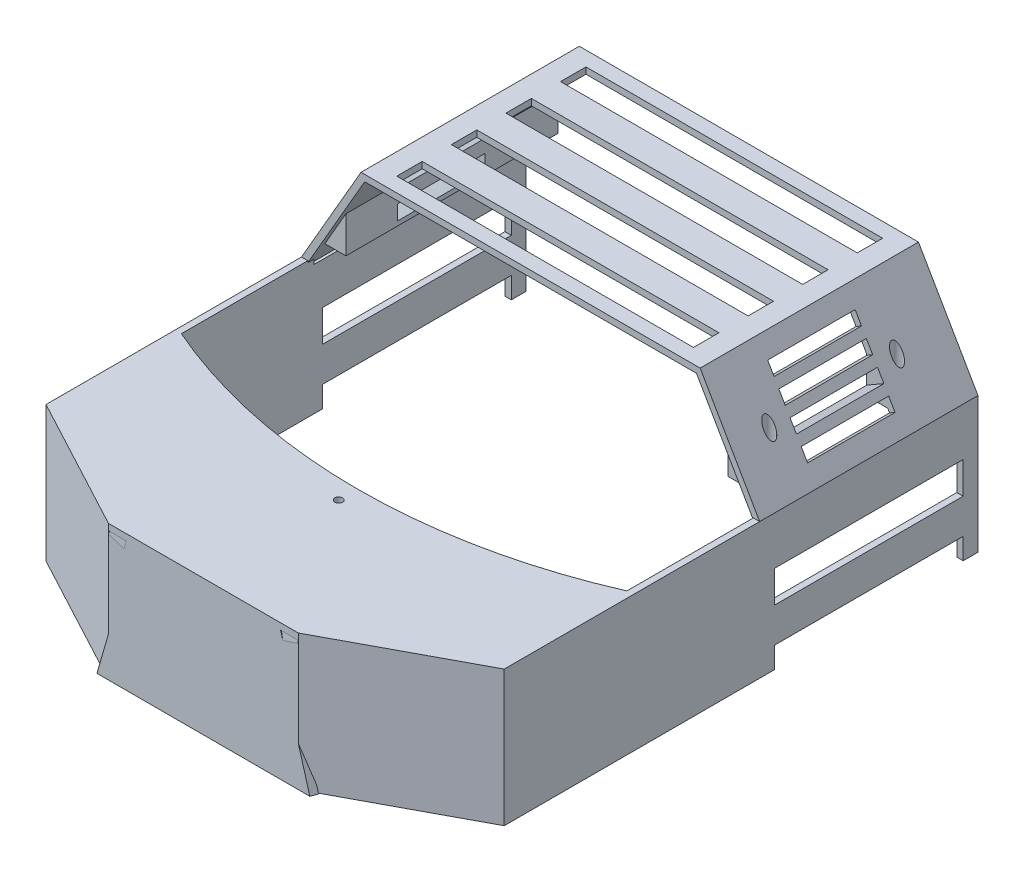
from build123d import *

# Parameters (mm, degrees)
SALIENTE_EXTRUIR15_DEPTH = 3
SALIENTE_EXTRUIR16_REACH = 85.791
CHAFL_N1_SIZE            = 8
CHAFL_N1_SIZE_2          = 2.205109306
CHAFL_N2_SIZE            = 2.205109306
CHAFL_N2_SIZE_2          = 8
SALIENTE_EXTRUIR17_DEPTH = 3
SALIENTE_EXTRUIR18_DEPTH = 102.97
CROQUIS28_R              = 1.825
CORTAR_EXTRUIR6_DEPTH    = 283.951050372
SALIENTE_EXTRUIR19_DEPTH = 100
CROQUIS30_R              = 1.65
CORTAR_EXTRUIR7_DEPTH    = 283.951050372
CORTAR_EXTRUIR9_REACH    = 302.941
CORTAR_EXTRUIR10_START   = -40.653307
CROQUIS34_R              = 2.5
CORTAR_EXTRUIR10_DEPTH   = 35
CROQUIS35_W              = 41.244426213
CROQUIS35_H              = 6
CORTAR_EXTRUIR11_DEPTH   = 17
CROQUIS36_W              = 41.244426207
CROQUIS36_H              = 6
CORTAR_EXTRUIR12_DEPTH   = 17
CROQUIS37_W              = 139.956448948
CROQUIS37_H              = 12
CORTAR_EXTRUIR13_DEPTH   = 3
CROQUIS39_W              = 88.97
CROQUIS39_H              = 15
CROQUIS39_H_2            = 10
CORTAR_EXTRUIR14_DEPTH   = 353.231866742
CHAFL_N4_SIZE            = 3.639702343
CHAFL_N4_SIZE_2          = 10


with BuildPart() as part:
    # Croquis22 → Saliente-Extruir15 (new body)
    with BuildSketch(Plane.XY):
        Polygon((-54, 0), (54, 0), (35.527349199, 64), (-35.527349199, 64), align=None)
    extrude(amount=SALIENTE_EXTRUIR15_DEPTH)

    # Saliente-Extruir16: up to this face of the body (flat: up to its plane)
    saliente_extruir16_end = Plane(part.part.faces().sort_by_distance((0, 0, 1.5))[0])
    # Croquis23 → Saliente-Extruir16 (add, up to the picked face)
    with BuildSketch(Plane(origin=(0, 64, 0), x_dir=(1, 0, 0), z_dir=(0, 1, 0)), mode=Mode.PRIVATE) as saliente_extruir16_sk1:
        Polygon((108.068224474, 30.82636567), (108.068224474, 254.28636567), (105.068224474, 254.28636567), (105.068224474, 32.737576452), (34.862265211, 0), (44.7636746, -3), align=None)
    saliente_extruir16_tool1 = split(extrude(saliente_extruir16_sk1.sketch, amount=-SALIENTE_EXTRUIR16_REACH, mode=Mode.PRIVATE), bisect_by=saliente_extruir16_end, keep=Keep.BOTH, mode=Mode.PRIVATE)
    # Croquis23 → Saliente-Extruir16 (add, up to the picked face)
    with BuildSketch(Plane(origin=(0, 64, 0), x_dir=(1, 0, 0), z_dir=(0, 1, 0)), mode=Mode.PRIVATE) as saliente_extruir16_sk2:
        Polygon((-44.7636746, -3), (-108.068224474, 30.82636567), (-108.068224474, 254.28636567), (-105.068224474, 254.28636567), (-105.068224474, 32.737576452), (-34.862265211, 0), align=None)
    saliente_extruir16_tool2 = split(extrude(saliente_extruir16_sk2.sketch, amount=-SALIENTE_EXTRUIR16_REACH, mode=Mode.PRIVATE), bisect_by=saliente_extruir16_end, keep=Keep.BOTH, mode=Mode.PRIVATE)
    add(saliente_extruir16_tool1.solids().sort_by(Axis((105.393241, 64, -142.556366), (0, -1, 0)))[0])
    add(saliente_extruir16_tool2.solids().sort_by(Axis((-75.155279, 64, -16.272473), (0, -1, 0)))[0])

    # Chaflán1
    # the kernel refuses this chamfer: 8, 2.205109306 mm, written as the material it adds along each edge
    with BuildSketch(Plane(origin=(-50.503325007, 12.114514694, 4.739040428), x_dir=(-0.919298302367056, 0.2887303877017334, 0.267442319917128), z_dir=(0.2763409092722936, 0.9574055388276669, -0.0837277497886264))) as chafl_n1_piece_1_section:
        Polygon((CHAFL_N1_SIZE * 0.999943641705, CHAFL_N1_SIZE * 0.0106166574103), (CHAFL_N1_SIZE_2 * 0.268384707917, CHAFL_N1_SIZE_2 * 0.963311812656), (0, 0), align=None)
    chafl_n1_piece_1 = extrude(amount=74.96402277, mode=Mode.PRIVATE)
    chafl_n1_piece_1 = split(chafl_n1_piece_1, bisect_by=Plane(origin=(-40.189826284, 64, 2.253573464), z_dir=(0, -1, 0)), keep=Keep.TOP, mode=Mode.PRIVATE)
    chafl_n1_piece_1 = split(chafl_n1_piece_1, bisect_by=Plane(origin=(-40.189826284, 55.464802275, 3), z_dir=(0, 0, -1)), keep=Keep.TOP, mode=Mode.PRIVATE)
    add(chafl_n1_piece_1)

    # Chaflán2
    # the kernel refuses this chamfer: 8, 2.205109306 mm, written as the material it adds along each edge
    with BuildSketch(Plane(origin=(50.503325007, 12.114514694, 4.739040428), x_dir=(-0.1610184044916604, 0.03976595413217484, 0.9861499593403216), z_dir=(-0.27634090927229366, 0.957405538827667, -0.08372774978862642))) as chafl_n2_piece_1_section:
        Polygon((CHAFL_N2_SIZE * 0.989624861472, CHAFL_N2_SIZE * 0.143675444677), (CHAFL_N2_SIZE_2 * 0.137719182616, CHAFL_N2_SIZE_2 * 0.990471315455), (0, 0), align=None)
    chafl_n2_piece_1 = extrude(amount=74.96402277, mode=Mode.PRIVATE)
    chafl_n2_piece_1 = split(chafl_n2_piece_1, bisect_by=Plane(origin=(40.189826284, 55.464802275, 3), z_dir=(0, 0, -1)), keep=Keep.TOP, mode=Mode.PRIVATE)
    chafl_n2_piece_1 = split(chafl_n2_piece_1, bisect_by=Plane(origin=(40.189826284, 64, 2.253573464), z_dir=(0, -1, 0)), keep=Keep.TOP, mode=Mode.PRIVATE)
    add(chafl_n2_piece_1)

    # Croquis24 → Saliente-Extruir17 (add)
    with BuildSketch(Plane(origin=(0, 64, 0), x_dir=(1, 0, 0), z_dir=(0, 1, 0))):
        with BuildLine():
            Line((-108.068224474, 93.00636567), (-108.068224474, 30.82636567))
            Line((-108.068224474, 30.82636567), (-44.7636746, -3))
            Line((-44.7636746, -3), (44.7636746, -3))
            Line((44.7636746, -3), (108.068224474, 30.82636567))
            Line((108.068224474, 30.82636567), (108.068224474, 93.00636567))
            ThreePointArc((108.068224474, 93.00636567), (0, 69.74), (-108.068224474, 93.00636567))
        make_face()
    extrude(amount=-SALIENTE_EXTRUIR17_DEPTH)

    # Croquis25 → Saliente-Extruir18 (add)
    with BuildSketch(Plane(origin=(0, 0, -254.28636567), x_dir=(-1, 0, 0), z_dir=(0, 0, -1))):
        Polygon((-108.068224474, 64), (-79.978224474, 112.653307185), (79.978224474, 112.653307185), (108.068224474, 64), (105.068224474, 63.196152423), (78.246173666, 109.653307185), (-78.246173666, 109.653307185), (-105.068224474, 63.196152423), align=None)
    extrude(amount=-SALIENTE_EXTRUIR18_DEPTH)

    # Croquis28 → Cortar-Extruir6 (cut, through all)
    with BuildSketch(Plane.XZ.offset(-61)):
        with Locations(Location((-0.001775526, -60.825, 0), (0, 0, 270))):
            Circle(CROQUIS28_R)
    extrude(amount=-CORTAR_EXTRUIR6_DEPTH, mode=Mode.SUBTRACT)

    # Croquis29 → Saliente-Extruir19 (add)
    with BuildSketch(Plane(origin=(0, 0, -254.28636567), x_dir=(-1, 0, 0), z_dir=(0, 0, -1))):
        Polygon((-105.068224474, 61), (-90.068224474, 61), (-90.068224474, 89.176914536), (-105.068224474, 63.196152423), align=None)
        Polygon((105.068224474, 61), (105.068224474, 63.196152423), (90.068224474, 89.176914536), (90.068224474, 61), align=None)
    extrude(amount=-SALIENTE_EXTRUIR19_DEPTH)

    # Croquis30 → Cortar-Extruir7 (cut, through all)
    with BuildSketch(Plane.XZ.offset(-61)):
        with Locations(Location((94.857727132, -169.052479414, 0), (0, 0, 270))):
            Circle(CROQUIS30_R)
        with Locations(Location((94.857727132, -229.296905627, 0), (0, 0, 270))):
            Circle(CROQUIS30_R)
        with Locations(Location((-94.857727132, -229.296905627, 0), (0, 0, 180))):
            Circle(CROQUIS30_R)
        with Locations(Location((-94.857727132, -169.052479414, 0), (0, 0, 180))):
            Circle(CROQUIS30_R)
    extrude(amount=-CORTAR_EXTRUIR7_DEPTH, mode=Mode.SUBTRACT)

    # Cortar-Extruir9: up to this face of the body (flat: up to its plane)
    cortar_extruir9_end = Plane(part.part.faces().sort_by_distance((95.429754053, 70.445236449, -154.28636567))[0])
    # Croquis33 → Cortar-Extruir9 (cut, up to the picked face)
    with BuildSketch(Plane(origin=(0, 0, -254.28636567), x_dir=(-1, 0, 0), z_dir=(0, 0, -1)), mode=Mode.PRIVATE) as cortar_extruir9_sk1:
        Polygon((-90.068224474, 61), (-90.068224474, 72), (-99.985320705, 72), (-106.336173666, 61), align=None)
    cortar_extruir9_tool1 = split(extrude(cortar_extruir9_sk1.sketch, amount=-CORTAR_EXTRUIR9_REACH, mode=Mode.PRIVATE), bisect_by=cortar_extruir9_end, keep=Keep.BOTH, mode=Mode.PRIVATE)
    # Croquis33 → Cortar-Extruir9 (cut, up to the picked face)
    with BuildSketch(Plane(origin=(0, 0, -254.28636567), x_dir=(-1, 0, 0), z_dir=(0, 0, -1)), mode=Mode.PRIVATE) as cortar_extruir9_sk2:
        Polygon((99.985320705, 72), (106.336173666, 61), (90.068224474, 61), (90.068224474, 72), align=None)
    cortar_extruir9_tool2 = split(extrude(cortar_extruir9_sk2.sketch, amount=-CORTAR_EXTRUIR9_REACH, mode=Mode.PRIVATE), bisect_by=cortar_extruir9_end, keep=Keep.BOTH, mode=Mode.PRIVATE)
    add(cortar_extruir9_tool1.solids().sort_by(Axis((96.742846, 66.055348, -254.286366), (0, 0, 1)))[0], mode=Mode.SUBTRACT)
    add(cortar_extruir9_tool2.solids().sort_by(Axis((-96.742846, 66.055348, -254.286366), (0, 0, 1)))[0], mode=Mode.SUBTRACT)

    # Croquis34 → Cortar-Extruir10 (cut)
    with BuildSketch(Plane.XZ.offset(-72).offset(CORTAR_EXTRUIR10_START)):
        with Locations(Location((94.857727132, -169.052479414, 0), (0, 0, 90))):
            Circle(CROQUIS34_R)
        with Locations(Location((94.857727132, -229.296905627, 0), (0, 0, 90))):
            Circle(CROQUIS34_R)
        with Locations(Location((-94.860104661, -169.05116859, 0), (0, 0, 90))):
            Circle(CROQUIS34_R)
        with Locations(Location((-94.860937159, -229.295594797, 0), (0, 0, 90))):
            Circle(CROQUIS34_R)
    extrude(amount=CORTAR_EXTRUIR10_DEPTH, mode=Mode.SUBTRACT)

    # Croquis35 → Cortar-Extruir11 (cut)
    with BuildSketch(Plane(origin=(108.763981276, 62.794913868, 0), x_dir=(0, 0, -1), z_dir=(0.8660254037844364, 0.5000000000000041, 0))):
        with Locations((199.174692521, 34.754013605)):
            Rectangle(CROQUIS35_W, CROQUIS35_H)
        with Locations((199.174692521, 45.299013605)):
            Rectangle(CROQUIS35_W, CROQUIS35_H)
        with Locations((199.174692521, 24.209013605)):
            Rectangle(CROQUIS35_W, CROQUIS35_H)
        with Locations((199.174692521, 13.664013605)):
            Rectangle(CROQUIS35_W, CROQUIS35_H)
    extrude(amount=-CORTAR_EXTRUIR11_DEPTH, mode=Mode.SUBTRACT)

    # Croquis36 → Cortar-Extruir12 (cut)
    with BuildSketch(Plane(origin=(-108.763981276, 62.794913868, 0), x_dir=(0, 0, 1), z_dir=(-0.8660254037844363, 0.500000000000004, 0))):
        with Locations((-199.173381694, 33.498068951)):
            Rectangle(CROQUIS36_W, CROQUIS36_H)
        with Locations((-199.173381694, 44.880365387)):
            Rectangle(CROQUIS36_W, CROQUIS36_H)
        Polygon((-219.795070879, 19.114529475), (-219.795432544, 25.114529465), (-178.551006411, 25.117015574), (-178.550644747, 19.117015585), align=None)
        Polygon((-219.794384783, 7.73223306), (-178.549958651, 7.734719169), (-178.550320316, 13.734719158), (-219.794746448, 13.732233049), align=None)
    extrude(amount=-CORTAR_EXTRUIR12_DEPTH, mode=Mode.SUBTRACT)

    # Croquis37 → Cortar-Extruir13 (cut)
    with BuildSketch(Plane(origin=(0, 112.653307185, 0), x_dir=(1, 0, 0), z_dir=(0, 1, 0))):
        with Locations((0, 241.41511567)):
            Rectangle(CROQUIS37_W, CROQUIS37_H)
        with Locations((0, 215.67261567)):
            Rectangle(CROQUIS37_W, CROQUIS37_H)
        with Locations((0, 189.93011567)):
            Rectangle(CROQUIS37_W, CROQUIS37_H)
        with Locations((0, 164.18761567)):
            Rectangle(CROQUIS37_W, CROQUIS37_H)
    extrude(amount=-CORTAR_EXTRUIR13_DEPTH, mode=Mode.SUBTRACT)

    # Croquis39 → Cortar-Extruir14 (cut, through all)
    with BuildSketch(Plane.ZY.offset(108.068224474)):
        with Locations((-202.80136567, 33.877807024)):
            Rectangle(CROQUIS39_W, CROQUIS39_H)
        with Locations((-202.80136567, 5)):
            Rectangle(CROQUIS39_W, CROQUIS39_H_2)
    extrude(amount=-CORTAR_EXTRUIR14_DEPTH, mode=Mode.SUBTRACT)

    # Chaflán4
    # the kernel refuses this chamfer: 10, 3.639702343 mm, written as the material it takes off along each edge
    with BuildSketch(Plane(origin=(61.194082129, -24.924482209, 3), x_dir=(-0.9560553519940534, -0.27595119786771466, 0.0990409022520496), z_dir=(-0.27731465330238175, 0.9607791541575931, 0))) as chafl_n4_piece_1_section:
        Polygon((CHAFL_N4_SIZE * 0.995083363089, -CHAFL_N4_SIZE * 0.0990409022429), (-CHAFL_N4_SIZE_2 * 0.099040902252, -CHAFL_N4_SIZE_2 * 0.995083363182), (0, 0), align=None)
    chafl_n4_piece_1 = extrude(amount=85.19019596, mode=Mode.PRIVATE)
    chafl_n4_piece_1 = split(chafl_n4_piece_1, bisect_by=Plane(origin=(49.101684897, 9.648205997, 0.682013017), z_dir=(0.47128163735993633, 0, 0.881982776638715)), keep=Keep.TOP, mode=Mode.PRIVATE)
    add(chafl_n4_piece_1, mode=Mode.SUBTRACT)
    with BuildSketch(Plane(origin=(-37.569592471, 56.924482209, 3), x_dir=(0.9560553519940533, -0.27595119786771466, 0.09904090225204958), z_dir=(-0.27731465330238175, -0.9607791541575931, 0))) as chafl_n4_piece_2_section:
        Polygon((CHAFL_N4_SIZE * 0.995083363089, -CHAFL_N4_SIZE * 0.0990409022429), (-CHAFL_N4_SIZE_2 * 0.0990409022521, -CHAFL_N4_SIZE_2 * 0.995083363182), (0, 0), align=None)
    chafl_n4_piece_2 = extrude(amount=85.19019596, mode=Mode.PRIVATE)
    chafl_n4_piece_2 = split(chafl_n4_piece_2, bisect_by=Plane(origin=(-49.101684897, 9.648205997, 0.682013017), z_dir=(-0.47128163735993633, 0, 0.881982776638715)), keep=Keep.TOP, mode=Mode.PRIVATE)
    add(chafl_n4_piece_2, mode=Mode.SUBTRACT)


solid = part.part
